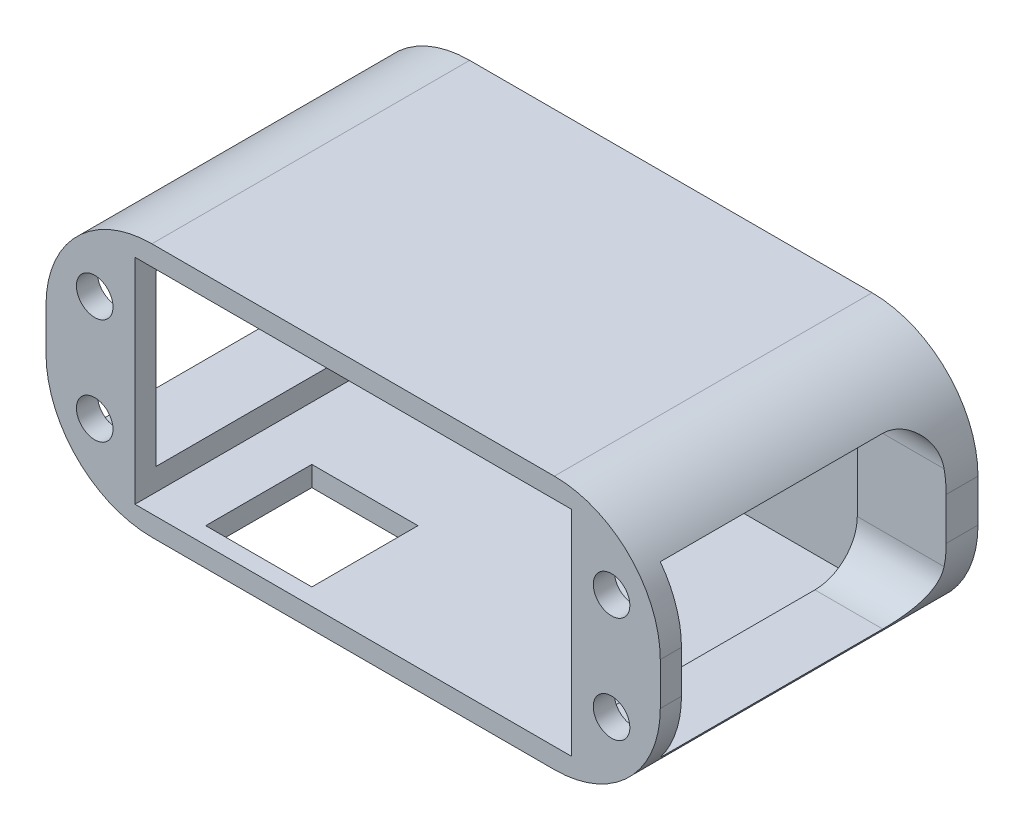
from build123d import *

# Parameters (mm, degrees)
SKETCH1_W                 = 58
SKETCH1_H                 = 24
BOSS_EXTRUDE1_DEPTH       = 30
F_8_32_TAPPED_HOLE2_D     = 3.4544
F_8_32_TAPPED_HOLE2_DEPTH = 12
F_8_32_TAPPED_HOLE2_TIP   = 1.037806461
SKETCH18_W                = 41.2
SKETCH18_H                = 20.2
CUT_EXTRUDE6_DEPTH        = 28
SKETCH22_R                = 1.505
CUT_EXTRUDE9_DEPTH        = 2
SKETCH24_W                = 10.02
SKETCH24_H                = 10.02
CUT_EXTRUDE11_DEPTH       = 2
FILLET1_R                 = 10
FILLET2_R                 = 10
FILLET3_R                 = 10
FILLET4_R                 = 10
SKETCH25_W                = 25
SKETCH25_H                = 16
CUT_EXTRUDE12_DEPTH       = 10
SKETCH27_W                = 25
SKETCH27_H                = 16
CUT_EXTRUDE13_DEPTH       = 10
FILLET6_R                 = 4
FILLET7_R                 = 4
FILLET8_R                 = 4
FILLET9_R                 = 4


with BuildPart() as part:
    # Sketch1 → Boss-Extrude1 (new body)
    with BuildSketch(Plane.XY):
        Rectangle(SKETCH1_W, SKETCH1_H)
    extrude(amount=-BOSS_EXTRUDE1_DEPTH)

    # #8-32 Tapped Hole2
    with Locations(Plane(origin=(24.4, -5, 0), x_dir=(1, 0, 0), z_dir=(0, 0, 1))):
        with Locations((0, 0), (0, 10), (-48.8, 0), (-48.8, 10)):
            Hole(F_8_32_TAPPED_HOLE2_D / 2, depth=F_8_32_TAPPED_HOLE2_DEPTH)
            with Locations((0, 0, -(F_8_32_TAPPED_HOLE2_DEPTH + F_8_32_TAPPED_HOLE2_TIP / 2))):  # 118° drill point
                Cone(0, F_8_32_TAPPED_HOLE2_D / 2, F_8_32_TAPPED_HOLE2_TIP, mode=Mode.SUBTRACT)

    # Sketch18 → Cut-Extrude6 (cut)
    with BuildSketch(Plane.XY):
        Rectangle(SKETCH18_W, SKETCH18_H)
    extrude(amount=-CUT_EXTRUDE6_DEPTH, mode=Mode.SUBTRACT)

    # Sketch22 → Cut-Extrude9 (cut)
    with BuildSketch(Plane(origin=(0, 0, -30), x_dir=(-1, 0, 0), z_dir=(0, 0, -1))):
        with Locations((10.5, 0)):
            Circle(SKETCH22_R)
    extrude(amount=-CUT_EXTRUDE9_DEPTH, mode=Mode.SUBTRACT)

    # Sketch24 → Cut-Extrude11 (cut)
    with BuildSketch(Plane(origin=(0, -10.1, 0), x_dir=(1, 0, 0), z_dir=(0, 1, 0))):
        with Locations((-10.5, 6.6)):
            Rectangle(SKETCH24_W, SKETCH24_H)
    extrude(amount=-CUT_EXTRUDE11_DEPTH, mode=Mode.SUBTRACT)

    # Fillet1
    fillet1_edges = [part.edges().sort_by_distance(p)[0] for p in [
        (-29, 12, -15),
    ]]
    fillet(fillet1_edges, radius=FILLET1_R)

    # Fillet2
    fillet2_edges = [part.edges().sort_by_distance(p)[0] for p in [
        (29, 12, -15),
    ]]
    fillet(fillet2_edges, radius=FILLET2_R)

    # Fillet3
    fillet3_edges = [part.edges().sort_by_distance(p)[0] for p in [
        (29, -12, -15),
    ]]
    fillet(fillet3_edges, radius=FILLET3_R)

    # Fillet4
    fillet4_edges = [part.edges().sort_by_distance(p)[0] for p in [
        (-29, -12, -15),
    ]]
    fillet(fillet4_edges, radius=FILLET4_R)

    # Sketch25 → Cut-Extrude12 (cut)
    with BuildSketch(Plane.ZY.offset(29)):
        with Locations((-14.5, 0)):
            Rectangle(SKETCH25_W, SKETCH25_H)
    extrude(amount=-CUT_EXTRUDE12_DEPTH, mode=Mode.SUBTRACT)

    # Sketch27 → Cut-Extrude13 (cut)
    with BuildSketch(Plane(origin=(29, 0, 0), x_dir=(0, 0, -1), z_dir=(1, 0, 0))):
        with Locations((14.5, 0)):
            Rectangle(SKETCH27_W, SKETCH27_H)
    extrude(amount=-CUT_EXTRUDE13_DEPTH, mode=Mode.SUBTRACT)

    # Fillet6
    fillet6_edges = [part.edges().sort_by_distance(p)[0] for p in [
        (23.8, -8, -27),
    ]]
    fillet(fillet6_edges, radius=FILLET6_R)

    # Fillet7
    fillet7_edges = [part.edges().sort_by_distance(p)[0] for p in [
        (23.8, 8, -27),
    ]]
    fillet(fillet7_edges, radius=FILLET7_R)

    # Fillet8
    fillet8_edges = [part.edges().sort_by_distance(p)[0] for p in [
        (-23.8, -8, -27),
    ]]
    fillet(fillet8_edges, radius=FILLET8_R)

    # Fillet9
    fillet9_edges = [part.edges().sort_by_distance(p)[0] for p in [
        (-23.8, 8, -27),
    ]]
    fillet(fillet9_edges, radius=FILLET9_R)


solid = part.part
